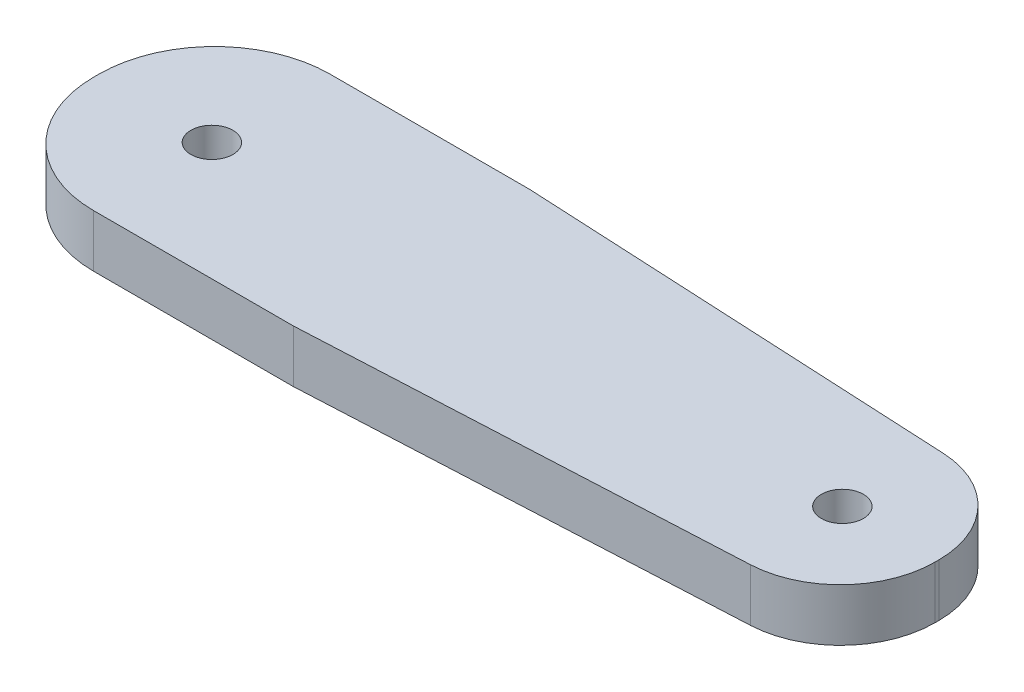
from build123d import *

# Parameters (mm, degrees)
SKETCH1_W           = 190
SKETCH1_H           = 45
BOSS_EXTRUDE1_DEPTH = 10
SKETCH2_R           = 4
CUT_EXTRUDE1_DEPTH  = 10
SKETCH3_W           = 30
SKETCH3_H           = 45
CUT_EXTRUDE2_DEPTH  = 10
FILLET1_R           = 18
FILLET2_R           = 22


with BuildPart() as part:
    # Sketch1 → Boss-Extrude1 (new body)
    with BuildSketch(Plane(origin=(0, 0, 0), x_dir=(1, 0, 0), z_dir=(0, 1, 0))):
        Rectangle(SKETCH1_W, SKETCH1_H)
    extrude(amount=BOSS_EXTRUDE1_DEPTH)

    # Sketch2 → Cut-Extrude1 (cut)
    with BuildSketch(Plane(origin=(0, 10, 0), x_dir=(1, 0, 0), z_dir=(0, 1, 0))):
        with Locations((-43, 0)):
            Circle(SKETCH2_R)
        with Locations((77, 0)):
            Circle(SKETCH2_R)
    extrude(amount=-CUT_EXTRUDE1_DEPTH, mode=Mode.SUBTRACT)

    # Sketch3 → Cut-Extrude2 (cut)
    with BuildSketch(Plane(origin=(0, 10, 0), x_dir=(1, 0, 0), z_dir=(0, 1, 0))):
        Polygon((95, -22.5), (-5, -22.5), (95, -17.5), align=None)
        Polygon((-5, 22.5), (95, 17.5), (95, 22.5), align=None)
        with Locations((-80, 0)):
            Rectangle(SKETCH3_W, SKETCH3_H)
    extrude(amount=-CUT_EXTRUDE2_DEPTH, mode=Mode.SUBTRACT)

    # Fillet1
    fillet1_edges = [part.edges().sort_by_distance(p)[0] for p in [
        (95, 5, -17.5),
        (95, 5, 17.5),
    ]]
    fillet(fillet1_edges, radius=FILLET1_R)

    # Fillet2
    fillet2_edges = [part.edges().sort_by_distance(p)[0] for p in [
        (-65, 5, -22.5),
        (-65, 5, 22.5),
    ]]
    fillet(fillet2_edges, radius=FILLET2_R)


solid = part.part
